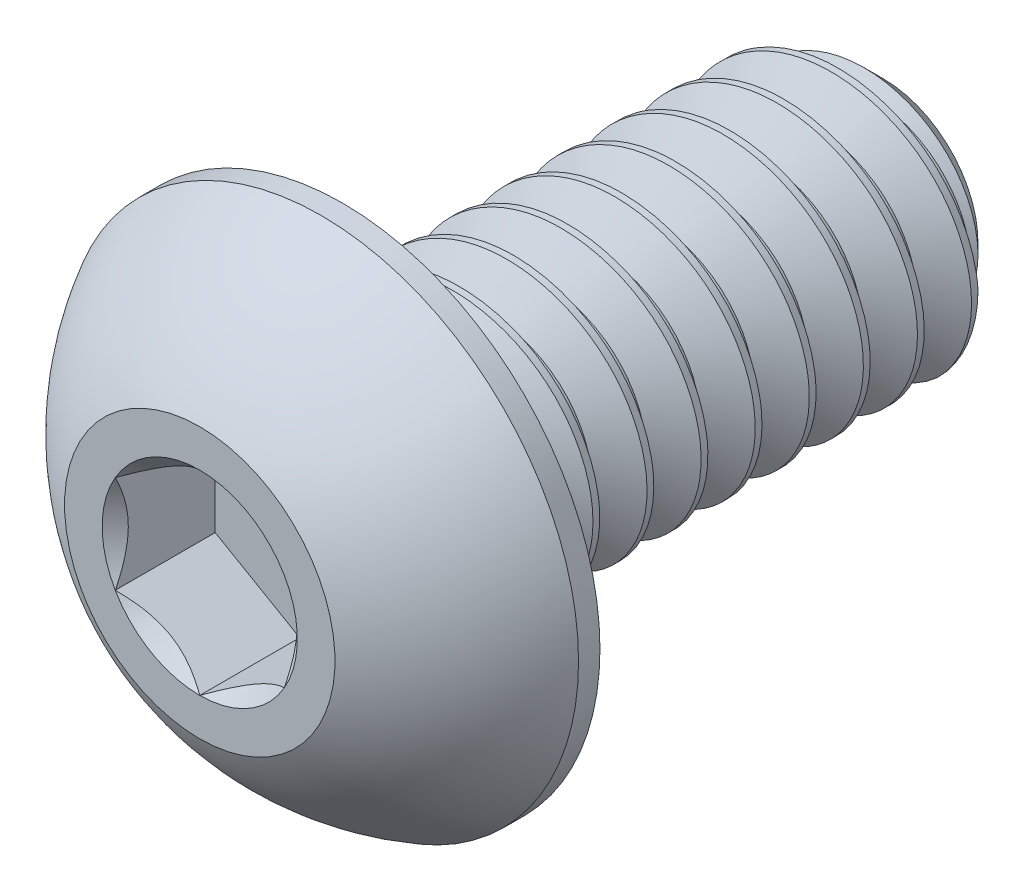
from build123d import *

# Parameters (mm, degrees)
SKETCH1_W          = 6.35
SKETCH1_H          = 1.5875
CHAMFER1_SIZE      = 0.47625
CUT_SWEEP1_PITCH   = 0.635
CUT_EXTRUDE2_DEPTH = 1.17348


with BuildPart() as part:
    # Sketch1 → Revolve1 (revolve)
    with BuildSketch(Plane(origin=(0, 0, 0), x_dir=(0, 0, -1), z_dir=(1, 0, 0))):
        with Locations((4.8514, 0.79375)):
            Rectangle(SKETCH1_W, SKETCH1_H)
    revolve(axis=Axis((0, 0, -8.0264), (0, 0, 1)))

    # Chamfer1
    chamfer1_edges = [part.edges().sort_by_distance(p)[0] for p in [
        (0, -1.5875, -8.0264),
    ]]
    chamfer(chamfer1_edges, length=CHAMFER1_SIZE)

    # Cut-Sweep1: the profile of Sketch2 profile screwed along a right-hand helix of 11 turns, 6 arcs to a turn; built about Z, then put on its axis
    cut_sweep1_z = Axis((0, 0, 0), (0, 0, 1))
    cut_sweep1_corners = [(1.5878, 0, 0.000173205), (1.5878, 0, -0.555798205), (1.175055401, 0, -0.3175), (1.175055401, 0, -0.238125)]
    with BuildLine(mode=Mode.PRIVATE) as cut_sweep1_profile:
        Line(cut_sweep1_corners[0], cut_sweep1_corners[1])
        Line(cut_sweep1_corners[1], cut_sweep1_corners[2])
        Line(cut_sweep1_corners[2], cut_sweep1_corners[3])
        Line(cut_sweep1_corners[3], cut_sweep1_corners[0])
    cut_sweep1_cap = Face(cut_sweep1_profile.wire())
    cut_sweep1_turn_angles = [0, 30, 60, 90, 120, 150, 180, 210, 240, 270, 300, 330, 360]
    cut_sweep1_turn_weights = [1, 0.8660254037844387, 1, 0.8660254037844387, 1, 0.8660254037844387, 1, 0.8660254037844387, 1, 0.8660254037844387, 1, 0.8660254037844387, 1]
    cut_sweep1_turn_rails = [Edge.make_bspline([Vector(p[0], p[1], 0).rotate(cut_sweep1_z, cut_sweep1_turn_angles[k]) / cut_sweep1_turn_weights[k] + Vector(0, 0, p[2] + CUT_SWEEP1_PITCH * cut_sweep1_turn_angles[k] / 360) for k in range(13)], [0, 0, 0, 1, 1, 2, 2, 3, 3, 4, 4, 5, 5, 6, 6, 6], 2, cut_sweep1_turn_weights) for p in cut_sweep1_corners]
    cut_sweep1_turn_sides = [Face.make_surface_from_curves(cut_sweep1_turn_rails[p[0]], cut_sweep1_turn_rails[p[1]]) for p in [(0, 1), (1, 2), (2, 3), (3, 0)]]
    cut_sweep1 = Plane(origin=(0, 0, -8.0264), x_dir=(0, 1, 0), z_dir=(0, 0, 1)) * Solid(Shell([*[p.moved(Location((0, 0, CUT_SWEEP1_PITCH * i))) for i in range(11) for p in cut_sweep1_turn_sides], cut_sweep1_cap, cut_sweep1_cap.rotate(cut_sweep1_z, 3960).moved(Location((0, 0, CUT_SWEEP1_PITCH * 3960 / 360)))]))
    add(cut_sweep1, mode=Mode.SUBTRACT)

    # Sketch7 → Revolve2 (revolve)
    with BuildSketch(Plane(origin=(0, 0, 0), x_dir=(0, 0, -1), z_dir=(1, 0, 0)), mode=Mode.PRIVATE) as revolve2_sk:
        with BuildLine():
            Line((1.42494, 3.0226), (1.6764, 3.0226))
            Line((1.6764, 3.0226), (1.6764, 0))
            Line((1.6764, 0), (0, 0))
            Line((0, 0), (0, 1.5875))
            ThreePointArc((0, 1.5875), (0.604105098, 2.412647716), (1.42494, 3.0226))
        make_face()
    revolve(revolve2_sk.sketch.rotate(Axis((0, 0, 0), (0, 0, -1)), 189.336081704), axis=Axis((0, 0, 0), (0, 0, -1)))

    # Sketch5 → Cut-Extrude2 (cut)
    with BuildSketch(Plane.XY):
        Polygon((0.9921875, -0.57283972), (0.9921875, 0.57283972), (0, 1.14567944), (-0.9921875, 0.57283972), (-0.9921875, -0.57283972), (0, -1.14567944), align=None)
    extrude(amount=-CUT_EXTRUDE2_DEPTH, mode=Mode.SUBTRACT)

    # Cut-Extrude3 cone 1 section (through the dimple's axis) → Cut-Extrude3 (revolve, cut)
    with BuildSketch(Plane(origin=(0, 0, 0), x_dir=(0, -1, 0), z_dir=(1, 0, 0))):
        Polygon((0, 0), (1.14567944, 0), (0, 1.14567944), align=None)
    revolve(axis=Axis((0, 0, 0), (0, 0, -1)), mode=Mode.SUBTRACT)


solid = part.part
